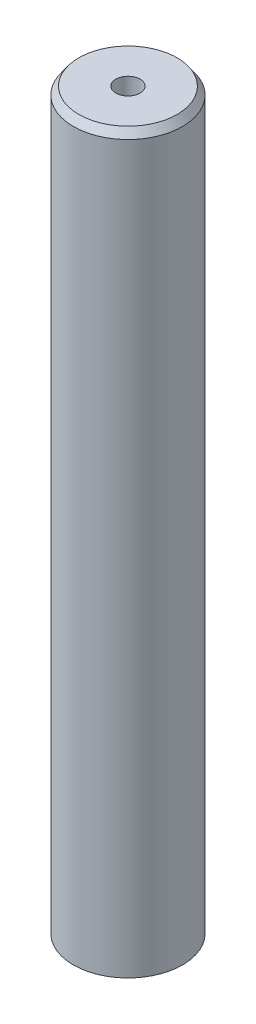
from build123d import *
from OCP.BRepFilletAPI import BRepFilletAPI_MakeChamfer

# Parameters (mm, degrees)
SKETCH1_R           = 7.5
BOSS_EXTRUDE1_DEPTH = 101.598586494
SKETCH2_R           = 1.666598469
CUT_EXTRUDE1_DEPTH  = 103.150735571
CHAMFER1_SIZE       = 1.059443278
CHAMFER1_SIZE2      = 0.748312403


with BuildPart() as part:
    # Sketch1 → Boss-Extrude1 (new body)
    with BuildSketch(Plane(origin=(0, 0, 0), x_dir=(1, 0, 0), z_dir=(0, 1, 0))):
        Circle(SKETCH1_R)
    extrude(amount=BOSS_EXTRUDE1_DEPTH)

    # Sketch2 → Cut-Extrude1 (cut, through all)
    with BuildSketch(Plane(origin=(0, 0, 0), x_dir=(1, 0, 0), z_dir=(0, 1, 0))):
        Circle(SKETCH2_R)
    extrude(amount=CUT_EXTRUDE1_DEPTH, mode=Mode.SUBTRACT)

    # Chamfer1: one chamfer whose edges measure the first distance from different faces: ONE call of the kernel's chamfer builder (chamfer() names one face for all edges)
    chamfer1_edges_1 = [part.edges().sort_by_distance(p)[0] for p in [
        (-7.5, 101.598586494, 0),
    ]]
    chamfer1_side_1 = [part.faces().sort_by_distance(p)[0] for p in [
        (-7.5, 50.799293247, 0),
    ]]
    chamfer1_edges_2 = [part.edges().sort_by_distance(p)[0] for p in [
        (-7.5, 0, 0),
    ]]
    chamfer1_side_2 = [part.faces().sort_by_distance(p)[0] for p in [
        (-7.287867966, 0, 0),
    ]]
    chamfer1 = BRepFilletAPI_MakeChamfer(part.part.solid().wrapped)
    for e in chamfer1_edges_1:
        chamfer1.Add(CHAMFER1_SIZE, CHAMFER1_SIZE2, e.wrapped, chamfer1_side_1[0].wrapped)  # the first distance lies on this face
    for e in chamfer1_edges_2:
        chamfer1.Add(CHAMFER1_SIZE, CHAMFER1_SIZE2, e.wrapped, chamfer1_side_2[0].wrapped)  # the first distance lies on this face
    add(Compound.cast(chamfer1.Shape()), mode=Mode.REPLACE)


solid = part.part
